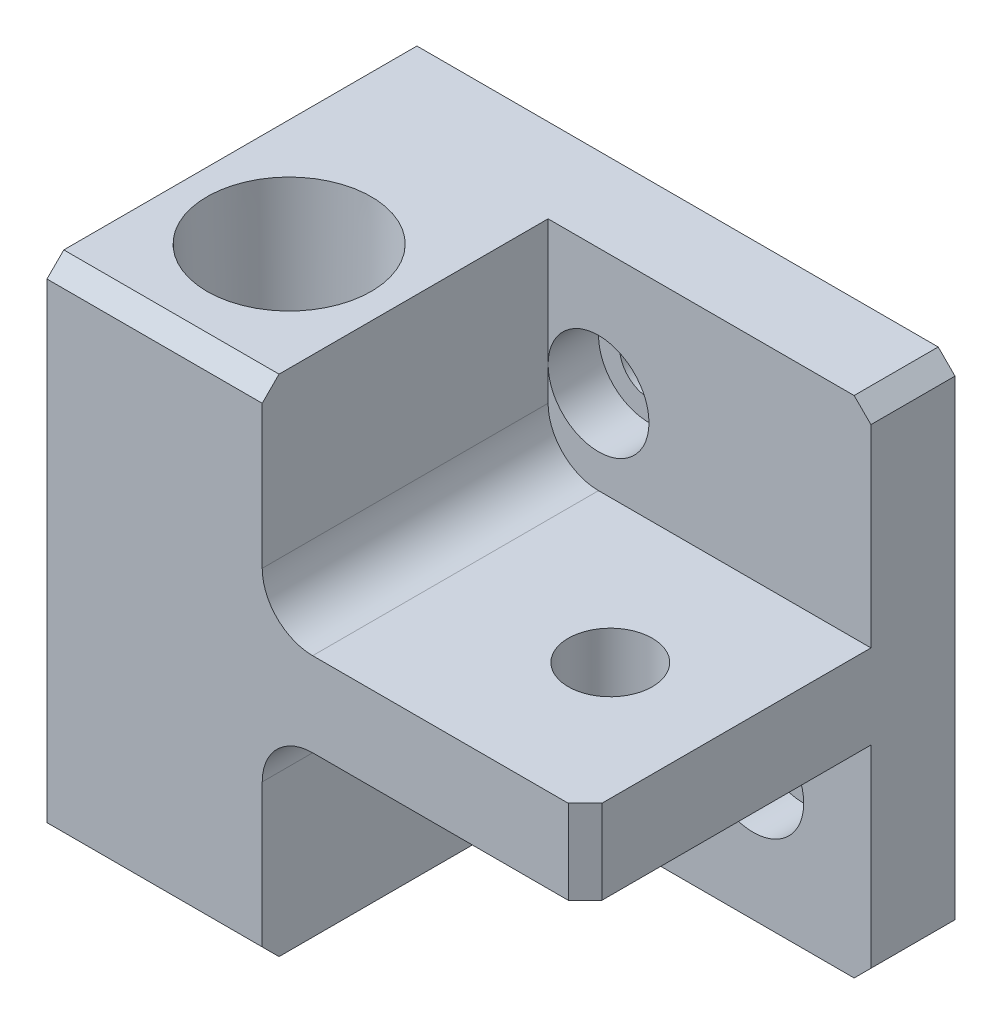
from build123d import *

# Parameters (mm, degrees)
SKETCH_2_W                = 32
SKETCH_2_H                = 30
EXTRUDE_1_DEPTH           = 11
HOLE_WIZARD_1_D           = 3.5
HOLE_WIZARD_1_CBORE_D     = 6
HOLE_WIZARD_1_CBORE_DEPTH = 20
SKETCH_11_W               = 19.2
SKETCH_11_H               = 12.5
CUT_EXTRUDE_1_DEPTH       = 17
HOLE_WIZARD_M6_1_D        = 5
CHAMFER_1_SIZE            = 1
FILLET_1_R                = 3


# Read off the part's stored shape, not the designer's step: 1/8 Rc 螺纹孔1
with BuildPart() as part:
    # 草图2 → 凸台-拉伸1 (new, symmetric)
    with BuildSketch(Plane.XY):
        Rectangle(SKETCH_2_W, SKETCH_2_H)
    extrude(amount=EXTRUDE_1_DEPTH, both=True)

    # 打孔尺寸根据内六角圆柱头螺钉的类型1 (through all)
    with Locations(Plane.XY.offset(11)):
        with Locations((-0.2, 7.5), (-0.2, -7.5), (9, -7.5)):
            CounterBoreHole(HOLE_WIZARD_1_D / 2, HOLE_WIZARD_1_CBORE_D / 2, HOLE_WIZARD_1_CBORE_DEPTH)

    # 草图11 → 切除-拉伸1 (cut)
    with BuildSketch(Plane.XY.offset(11)):
        with Locations((6.4, -8.75)):
            Rectangle(SKETCH_11_W, SKETCH_11_H)
        with Locations((6.4, 8.75)):
            Rectangle(SKETCH_11_W, SKETCH_11_H)
    extrude(amount=-CUT_EXTRUDE_1_DEPTH, mode=Mode.SUBTRACT)

    # M6 螺纹孔1 (through all)
    with Locations(Plane(origin=(0, -2.5, 0), x_dir=(-1, 0, 0), z_dir=(0, -1, 0))):
        with Locations((-9, -2.5)):
            Hole(HOLE_WIZARD_M6_1_D / 2)

    # 草图9 → 1/8 Rc 螺纹孔2 (revolve, cut)
    with BuildSketch(Plane(origin=(-9.6, -15, 3), x_dir=(0, 0, -1), z_dir=(1, 0, 0))):
        Polygon((0, 0), (0, 22.373399445), (3.95, 20), (3.95, 10), (4.632996789, 10), (4.945163, 0), align=None)
    revolve(axis=Axis((-9.6, -21.35, 3), (0, 1, 0)), mode=Mode.SUBTRACT)

    # 1/8 Rc 螺纹孔1 outline → 1/8 Rc 螺纹孔1 (revolve, cut)
    with BuildSketch(Plane(origin=(-9.6, 0, 3), x_dir=(1, 0, 0), z_dir=(0, 0, 1))):
        Polygon((4.632997031, 7), (4.88273, 15), (0, 15), (0, 7.373399445), (3.95, 5), (3.95, 7), align=None)
    revolve(axis=Axis((-9.6, 0, 3), (0, 1, 0)), mode=Mode.SUBTRACT)

    # 倒角1
    chamfer_1_edges = [part.edges().sort_by_distance(p)[0] for p in [
        (-9.6, -15, 11),
        (16, 0, 11),
        (16, -15, -8.5),
        (-9.6, 15, 11),
        (16, 15, -8.5),
    ]]
    chamfer(chamfer_1_edges, length=CHAMFER_1_SIZE)

    # 圆角1
    fillet_1_edges = [part.edges().sort_by_distance(p)[0] for p in [
        (-3.2, -2.5, 2.5),
        (-3.2, 2.5, 2.5),
    ]]
    fillet(fillet_1_edges, radius=FILLET_1_R)


solid = part.part
